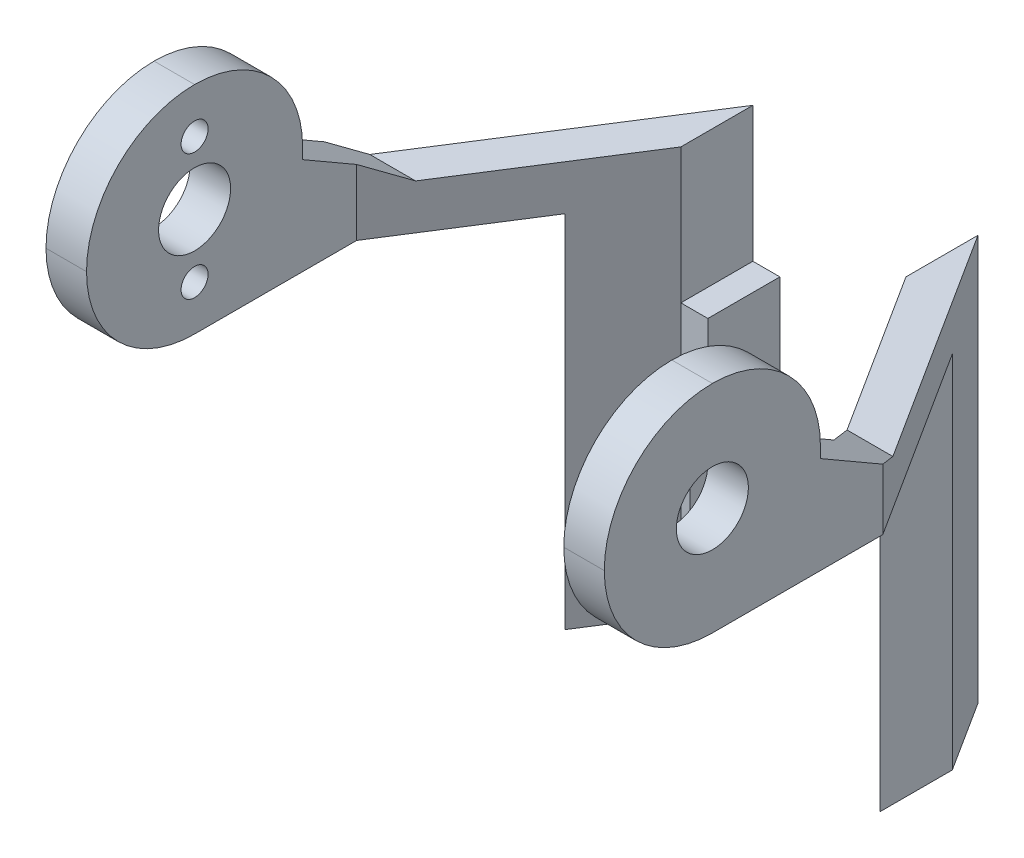
from build123d import *
from OCP.BRepFilletAPI import BRepFilletAPI_MakeChamfer

# Parameters (mm, degrees)
BOSS_EXTRUDE1_DEPTH     = 5
SKETCH2_W               = 4.5
SKETCH2_H               = 24
BOSS_EXTRUDE2_DEPTH     = 19
CUT_EXTRUDE1_REACH      = 59.853
SKETCH5_R               = 1.7
CUT_EXTRUDE2_REACH      = 73.673
SKETCH6_W               = 14
SKETCH6_H               = 3
CUT_EXTRUDE3_REACH      = 78.859
SKETCH7_R               = 1.5
CUT_EXTRUDE4_DEPTH      = 77.85863647
CUT_EXTRUDE4_DEPTH_BACK = 77.85863647
SKETCH8_R               = 4
FILLET1_R               = 12
CHAMFER2_SIZE           = 10
CHAMFER2_SIZE2          = 5.773502692
CUT_EXTRUDE5_REACH      = 59.853
SKETCH10_R              = 1.7
SKETCH_1_W              = 25
SKETCH_1_H              = 8
CUT_EXTRUDE_1_DEPTH     = 60.682493246
EXTRUDE_2_DEPTH         = 40
SKETCH_5_W              = 8
SKETCH_5_H              = 10
EXTRUDE_3_DEPTH         = 3
SKETCH_4_W              = 8
SKETCH_4_H              = 10
EXTRUDE_4_DEPTH         = 3
SKETCH_7_W              = 8
SKETCH_7_H              = 12
EXTRUDE_5_DEPTH         = 1


with BuildPart() as part:
    # Sketch1 → Boss-Extrude1 (new body)
    with BuildSketch(Plane(origin=(0, 0, 0), x_dir=(1, 0, 0), z_dir=(0, 1, 0))):
        Polygon((-31, 15.928571429), (-31, -15), (-26.5, -15), (-26.5, 15), (-12.5, 37), (12.5, 37), (26.5, 15), (26.5, -15), (31, -15), (31, 15.928571429), (12.5, 45), (-12.5, 45), align=None)
    extrude(amount=BOSS_EXTRUDE1_DEPTH)

    # Sketch2 → Boss-Extrude2 (add)
    with BuildSketch(Plane(origin=(0, 5, 0), x_dir=(1, 0, 0), z_dir=(0, 1, 0))):
        with Locations((-28.75, -3)):
            Rectangle(SKETCH2_W, SKETCH2_H)
        with Locations((28.75, -3)):
            Rectangle(SKETCH2_W, SKETCH2_H)
    extrude(amount=BOSS_EXTRUDE2_DEPTH)

    # Sketch5 → Cut-Extrude1 (cut, up to next)
    with BuildSketch(Plane(origin=(0, 5, 0), x_dir=(1, 0, 0), z_dir=(0, 1, 0)), mode=Mode.PRIVATE) as cut_extrude1_sk1:
        with Locations(Location((0, 41, 0), (0, 0, 270))):
            Circle(SKETCH5_R)
    cut_extrude1_tool1 = extrude(cut_extrude1_sk1.sketch, amount=-CUT_EXTRUDE1_REACH, mode=Mode.PRIVATE) & part.part
    add(cut_extrude1_tool1.solids().sort_by_distance((0, 5, -41))[0], mode=Mode.SUBTRACT)

    # Cut-Extrude2: up to this face of the body (flat: up to its plane)
    cut_extrude2_end = Plane(part.part.faces().sort_by_distance((0, 2.5, -37))[0])
    # Sketch6 → Cut-Extrude2 (cut, up to the picked face)
    with BuildSketch(Plane(origin=(0, 0, -45), x_dir=(-1, 0, 0), z_dir=(0, 0, -1)), mode=Mode.PRIVATE) as cut_extrude2_sk1:
        with Locations((0, 3.5)):
            Rectangle(SKETCH6_W, SKETCH6_H)
    cut_extrude2_tool1 = split(extrude(cut_extrude2_sk1.sketch, amount=-CUT_EXTRUDE2_REACH, mode=Mode.PRIVATE), bisect_by=cut_extrude2_end, keep=Keep.BOTH, mode=Mode.PRIVATE)
    add(cut_extrude2_tool1.solids().sort_by(Axis((0, 3.5, -45), (0, 0, 1)))[0], mode=Mode.SUBTRACT)

    # Sketch7 → Cut-Extrude3 (cut, up to next)
    with BuildSketch(Plane(origin=(-26.5, 0, 0), x_dir=(0, 0, -1), z_dir=(1, 0, 0)), mode=Mode.PRIVATE) as cut_extrude3_sk1:
        with Locations((-3, 19)):
            Circle(SKETCH7_R)
    cut_extrude3_tool1 = extrude(cut_extrude3_sk1.sketch, amount=-CUT_EXTRUDE3_REACH, mode=Mode.PRIVATE) & part.part
    # Sketch7 → Cut-Extrude3 (cut, up to next)
    with BuildSketch(Plane(origin=(-26.5, 0, 0), x_dir=(0, 0, -1), z_dir=(1, 0, 0)), mode=Mode.PRIVATE) as cut_extrude3_sk2:
        with Locations((-3, 5)):
            Circle(SKETCH7_R)
    cut_extrude3_tool2 = extrude(cut_extrude3_sk2.sketch, amount=-CUT_EXTRUDE3_REACH, mode=Mode.PRIVATE) & part.part
    add(cut_extrude3_tool1.solids().sort_by_distance((-26.5, 19, 3))[0], mode=Mode.SUBTRACT)
    add(cut_extrude3_tool2.solids().sort_by_distance((-26.5, 5, 3))[0], mode=Mode.SUBTRACT)

    # Sketch8 → Cut-Extrude4 (cut, two sides: drawn at the far end of the back side and taken through both)
    with BuildSketch(Plane(origin=(-26.5, 0, 0), x_dir=(0, 0, -1), z_dir=(1, 0, 0)).offset(-CUT_EXTRUDE4_DEPTH_BACK)):
        with Locations((-3, 12)):
            Circle(SKETCH8_R)
    extrude(amount=CUT_EXTRUDE4_DEPTH + CUT_EXTRUDE4_DEPTH_BACK, mode=Mode.SUBTRACT)

    # Fillet1
    fillet1_edges = [part.edges().sort_by_distance(p)[0] for p in [
        (28.75, 0, 15),
        (-28.75, 0, 15),
        (-28.75, 24, -9),
        (28.75, 24, -9),
        (28.75, 24, 15),
        (-28.75, 24, 15),
    ]]
    fillet(fillet1_edges, radius=FILLET1_R - 0.0001)  # a hair under: the kernel refuses the full size

    # Chamfer2: one chamfer whose edges measure the first distance from different faces: ONE call of the kernel's chamfer builder (chamfer() names one face for all edges)
    chamfer2_edges_1 = [part.edges().sort_by_distance(p)[0] for p in [
        (-28.75, 5, -9),
    ]]
    chamfer2_side_1 = [part.faces().sort_by_distance(p)[0] for p in [
        (-19.473621736, 5, -28.773341624),
    ]]
    chamfer2_edges_2 = [part.edges().sort_by_distance(p)[0] for p in [
        (28.75, 5, -9),
    ]]
    chamfer2_side_2 = [part.faces().sort_by_distance(p)[0] for p in [
        (19.473621736, 5, -28.773341624),
    ]]
    chamfer2 = BRepFilletAPI_MakeChamfer(part.part.solid().wrapped)
    for e in chamfer2_edges_1:
        chamfer2.Add(CHAMFER2_SIZE, CHAMFER2_SIZE2, e.wrapped, chamfer2_side_1[0].wrapped)  # the first distance lies on this face
    for e in chamfer2_edges_2:
        chamfer2.Add(CHAMFER2_SIZE, CHAMFER2_SIZE2, e.wrapped, chamfer2_side_2[0].wrapped)  # the first distance lies on this face
    add(Compound.cast(chamfer2.Shape()), mode=Mode.REPLACE)

    # Sketch10 → Cut-Extrude5 (cut, up to next)
    with BuildSketch(Plane(origin=(0, 5, 0), x_dir=(1, 0, 0), z_dir=(0, 1, 0)), mode=Mode.PRIVATE) as cut_extrude5_sk1:
        with Locations(Location((-10, 41, 0), (0, 0, 270))):
            Circle(SKETCH10_R)
    cut_extrude5_tool1 = extrude(cut_extrude5_sk1.sketch, amount=-CUT_EXTRUDE5_REACH, mode=Mode.PRIVATE) & part.part
    cut_extrude5 = cut_extrude5_tool1.solids().sort_by_distance((-10, 5, -41))[0]
    add(cut_extrude5, mode=Mode.SUBTRACT)

    # Mirror1: Cut-Extrude5 across plane
    add(cut_extrude5.mirror(Plane(origin=(0, 0, 0), x_dir=(0, 0, 1), z_dir=(1, 0, 0))), mode=Mode.SUBTRACT)

    # 草图1 → 切除-拉伸1 (cut, through all)
    with BuildSketch(Plane.XZ):
        with Locations((0, -41)):
            Rectangle(SKETCH_1_W, SKETCH_1_H)
    extrude(amount=-CUT_EXTRUDE_1_DEPTH, mode=Mode.SUBTRACT)


with BuildPart() as cut_extrude_1_piece_1:
    # of the separate pieces the step leaves, piece 1, a body of its own (cut_extrude_1_pieces)
    add(part.part.solids().sort_by_distance((31, 6.773290113, -15.928571429))[0])



with BuildPart() as cut_extrude_1_piece_2:
    # of the separate pieces the step leaves, piece 2, a body of its own (cut_extrude_1_pieces)
    add(part.part.solids().sort_by_distance((-31, 6.773290113, -15.928571429))[0])


with BuildPart() as cut_extrude_1_piece_1_1:
    add(cut_extrude_1_piece_1.part)

    add(cut_extrude_1_piece_2.part)  # 凸台-拉伸2 merges 切除-拉伸1 piece 2
    # 草图2 → 凸台-拉伸2 (add)
    with BuildSketch(Plane(origin=(0, 0, 0), x_dir=(-1, 0, 0), z_dir=(0, -1, 0))):
        Polygon((-12.5, 37), (-17.5, 29.142857143), (-17.5, 37.142857143), (-12.5, 45), align=None)
        Polygon((12.5, 37), (17.5, 29.142857143), (17.5, 37.142857143), (12.5, 45), align=None)
    extrude(amount=EXTRUDE_2_DEPTH)

    # 草图5 → 凸台-拉伸3 (add)
    with BuildSketch(Plane(origin=(-12.5, 0, 0), x_dir=(0, 0, -1), z_dir=(1, 0, 0))):
        with Locations((41, -15)):
            Rectangle(SKETCH_5_W, SKETCH_5_H)
    extrude(amount=EXTRUDE_3_DEPTH)

    # 草图4 → 凸台-拉伸4 (add)
    with BuildSketch(Plane.ZY.offset(-12.5)):
        with Locations((-41, -15)):
            Rectangle(SKETCH_4_W, SKETCH_4_H)
    extrude(amount=EXTRUDE_4_DEPTH)

    # 草图7 → 凸台-拉伸5 (add)
    with BuildSketch(Plane.ZY.offset(-12.5)):
        with Locations((-41, -32.5)):
            Rectangle(SKETCH_7_W, SKETCH_7_H)
    extrude_5 = extrude(amount=EXTRUDE_5_DEPTH)

    # 镜向1: 凸台-拉伸5 across plane
    add(extrude_5.mirror(Plane(origin=(0, 0, 0), x_dir=(0, 0, 1), z_dir=(1, 0, 0))))


solid = cut_extrude_1_piece_1_1.part
